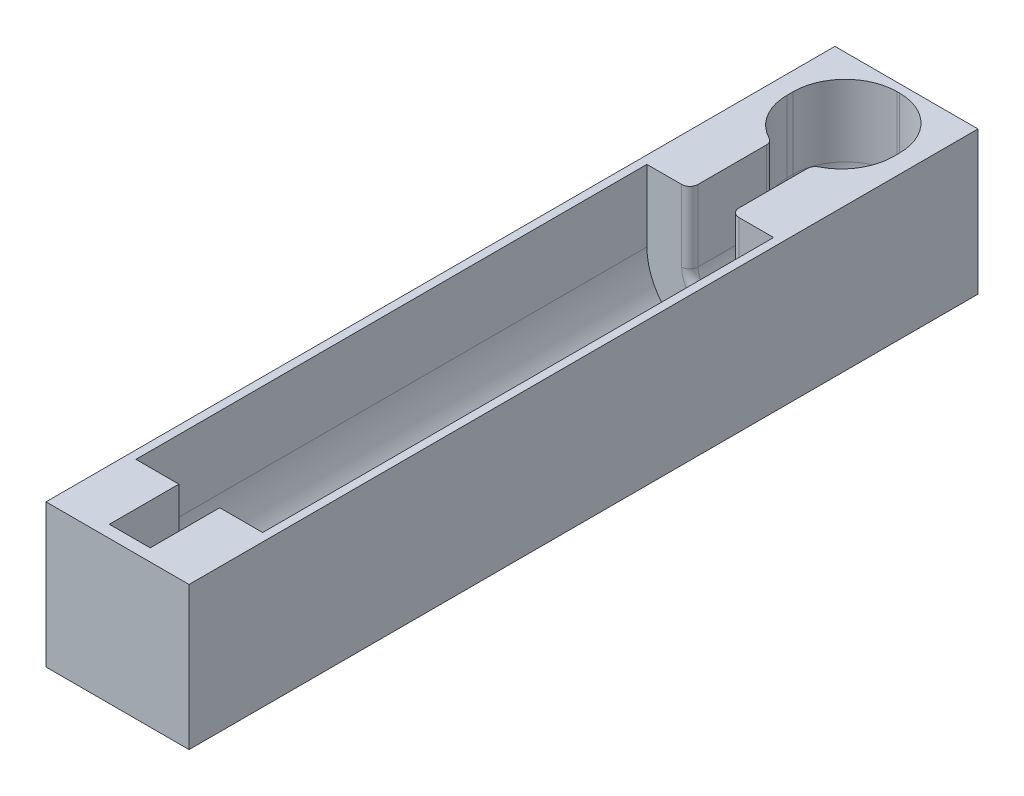
from build123d import *

# Parameters (mm, degrees)
BOSS_EXTRUDE3_DEPTH = 125
SKETCH4_W           = 35
SKETCH4_H           = 35
BOSS_EXTRUDE4_DEPTH = 20
CUT_EXTRUDE2_DEPTH  = 17
SKETCH6_W           = 35
SKETCH6_H           = 35
BOSS_EXTRUDE5_DEPTH = 48
CUT_EXTRUDE3_START  = -20
CUT_EXTRUDE3_DEPTH  = 20
CUT_EXTRUDE4_DEPTH  = 26
FILLET1_R           = 12.7
FILLET2_R           = 2


with BuildPart() as part:
    # Sketch1 → Boss-Extrude3 (new body)
    with BuildSketch(Plane.XY):
        with BuildLine():
            Line((0, -17.5), (-17.5, -17.5))
            Line((-17.5, -17.5), (-17.5, 0))
            Line((-17.5, 0), (-17.5, 17.5))
            Line((-17.5, 17.5), (-15.5, 17.5))
            Line((-15.5, 17.5), (-15.5, 0))
            ThreePointArc((-15.5, 0), (0, -15.5), (15.5, 0))
            Line((15.5, 0), (15.5, 17.5))
            Line((15.5, 17.5), (17.5, 17.5))
            Line((17.5, 17.5), (17.5, 0))
            Line((17.5, 0), (17.5, -17.5))
            Line((17.5, -17.5), (0, -17.5))
        make_face()
    extrude(amount=BOSS_EXTRUDE3_DEPTH)

    # Sketch4 → Boss-Extrude4 (add)
    with BuildSketch(Plane.XY.offset(125)):
        Rectangle(SKETCH4_W, SKETCH4_H)
    extrude(amount=BOSS_EXTRUDE4_DEPTH)

    # Sketch5 → Cut-Extrude2 (cut)
    with BuildSketch(Plane(origin=(0, 0, 125), x_dir=(-1, 0, 0), z_dir=(0, 0, -1))):
        with BuildLine():
            Line((-5, 0), (-5, 17.5))
            Line((-5, 17.5), (5, 17.5))
            Line((5, 17.5), (5, 0))
            ThreePointArc((5, 0), (0, -5), (-5, 0))
        make_face()
    extrude(amount=-CUT_EXTRUDE2_DEPTH, mode=Mode.SUBTRACT)

    # Sketch6 → Boss-Extrude5 (add)
    with BuildSketch(Plane(origin=(0, 0, 0), x_dir=(-1, 0, 0), z_dir=(0, 0, -1))):
        Rectangle(SKETCH6_W, SKETCH6_H)
    extrude(amount=BOSS_EXTRUDE5_DEPTH)

    # Sketch7 → Cut-Extrude3 (cut)
    with BuildSketch(Plane.XY.offset(CUT_EXTRUDE3_START)):
        with BuildLine():
            Line((-5, 0), (-5, 17.5))
            Line((-5, 17.5), (5, 17.5))
            Line((5, 17.5), (5, 0))
            ThreePointArc((5, 0), (0, -5), (-5, 0))
        make_face()
    extrude(amount=CUT_EXTRUDE3_DEPTH, mode=Mode.SUBTRACT)

    # Sketch8 → Cut-Extrude4 (cut)
    with BuildSketch(Plane.XY.offset(-20)):
        with BuildLine():
            Line((-13, 0), (-13, 27.339362416))
            Line((-13, 27.339362416), (13, 27.339362416))
            Line((13, 27.339362416), (13, 0))
            ThreePointArc((13, 0), (0, -13), (-13, 0))
        make_face()
    extrude(amount=-CUT_EXTRUDE4_DEPTH, mode=Mode.SUBTRACT)

    # Fillet1
    # the kernel refuses this fillet: 12.7 mm, written as the material it adds along each edge
    with BuildSketch(Plane(origin=(13, 17.5, -20), x_dir=(-1, 0, 0), z_dir=(0, -1, 0)), Plane(origin=(-13, 0, -20), x_dir=(1, 0, 0), z_dir=(0, 1, 0))) as fillet1_piece_1:
        with BuildLine():
            CenterArc((12.7, 11.798304963), FILLET1_R, 180, 68.279526527)
            Line((0, 11.798304963), (-0.254, 11.798304963))
            Line((-0.254, 11.798304963), (-0.254, 0))
            Line((-0.254, 0), (0, -0.254))
            ThreePointArc((0, -0.254), (4, -0.254), (7.906, -0.235966099))
            Line((7.906, -0.235966099), (8, 0))
        make_face()
    extrude(amount=17.5)
    with BuildSketch(Plane(origin=(0, 0, -20), x_dir=(1, 0, 0), z_dir=(0, 1, 0))) as fillet1_piece_2:
        with BuildLine():
            CenterArc((0.3, 11.798304963), FILLET1_R, 291.720473473, 68.279526527)
            Line((13, 11.798304963), (13.254, 11.798304963))
            Line((13.254, 11.798304963), (13.254, 0))
            Line((13.254, 0), (13, -0.254))
            ThreePointArc((13, -0.254), (9, -0.254), (5.094, -0.235966099))
            Line((5.094, -0.235966099), (5, 0))
        make_face()
    revolve(axis=Axis((0, 0, -20), (0, 0, -1)), revolution_arc=180)
    with BuildSketch(Plane(origin=(13, 17.5, -46), x_dir=(0, 0, 1), z_dir=(0, -1, 0))) as fillet1_piece_3:
        with BuildLine():
            CenterArc((FILLET1_R, FILLET1_R), FILLET1_R, 180, 90)
            Line((0, FILLET1_R), (-FILLET1_R * 0.02, FILLET1_R))
            Line((-FILLET1_R * 0.02, FILLET1_R), (-FILLET1_R * 0.02, -FILLET1_R * 0.02))
            Line((-FILLET1_R * 0.02, -FILLET1_R * 0.02), (FILLET1_R, -FILLET1_R * 0.02))
            Line((FILLET1_R, -FILLET1_R * 0.02), (FILLET1_R, 0))
        make_face()
    extrude(amount=17.5)
    with BuildSketch(Plane(origin=(0, 0, -46), x_dir=(1, 0, 0), z_dir=(0, 1, 0))) as fillet1_piece_4:
        with BuildLine():
            CenterArc((13 - FILLET1_R, -FILLET1_R), FILLET1_R, 0, 90)
            Line((13, -FILLET1_R), (13 + FILLET1_R * 0.02, -FILLET1_R))
            Line((13 + FILLET1_R * 0.02, -FILLET1_R), (13 + FILLET1_R * 0.02, FILLET1_R * 0.02))
            Line((13 + FILLET1_R * 0.02, FILLET1_R * 0.02), (13 - FILLET1_R, FILLET1_R * 0.02))
            Line((13 - FILLET1_R, FILLET1_R * 0.02), (13 - FILLET1_R, 0))
        make_face()
    revolve(axis=Axis((0, 0, -46), (0, 0, -1)), revolution_arc=180)
    with BuildSketch(Plane(origin=(-13, 0, -46), x_dir=(1, 0, 0), z_dir=(0, 1, 0))) as fillet1_piece_5:
        with BuildLine():
            CenterArc((FILLET1_R, -FILLET1_R), FILLET1_R, 90, 90)
            Line((0, -FILLET1_R), (-FILLET1_R * 0.02, -FILLET1_R))
            Line((-FILLET1_R * 0.02, -FILLET1_R), (-FILLET1_R * 0.02, FILLET1_R * 0.02))
            Line((-FILLET1_R * 0.02, FILLET1_R * 0.02), (FILLET1_R, FILLET1_R * 0.02))
            Line((FILLET1_R, FILLET1_R * 0.02), (FILLET1_R, 0))
        make_face()
    extrude(amount=17.5)

    # Fillet2
    fillet2_edges = [part.edges().sort_by_distance(p)[0] for p in [
        (0, -5, -20),
        (-5, 8.75, -20),
        (5, 8.75, -20),
        (0, -5, 0),
        (5, 8.75, 0),
        (-5, 8.75, 0),
    ]]
    fillet(fillet2_edges, radius=FILLET2_R)


solid = part.part
